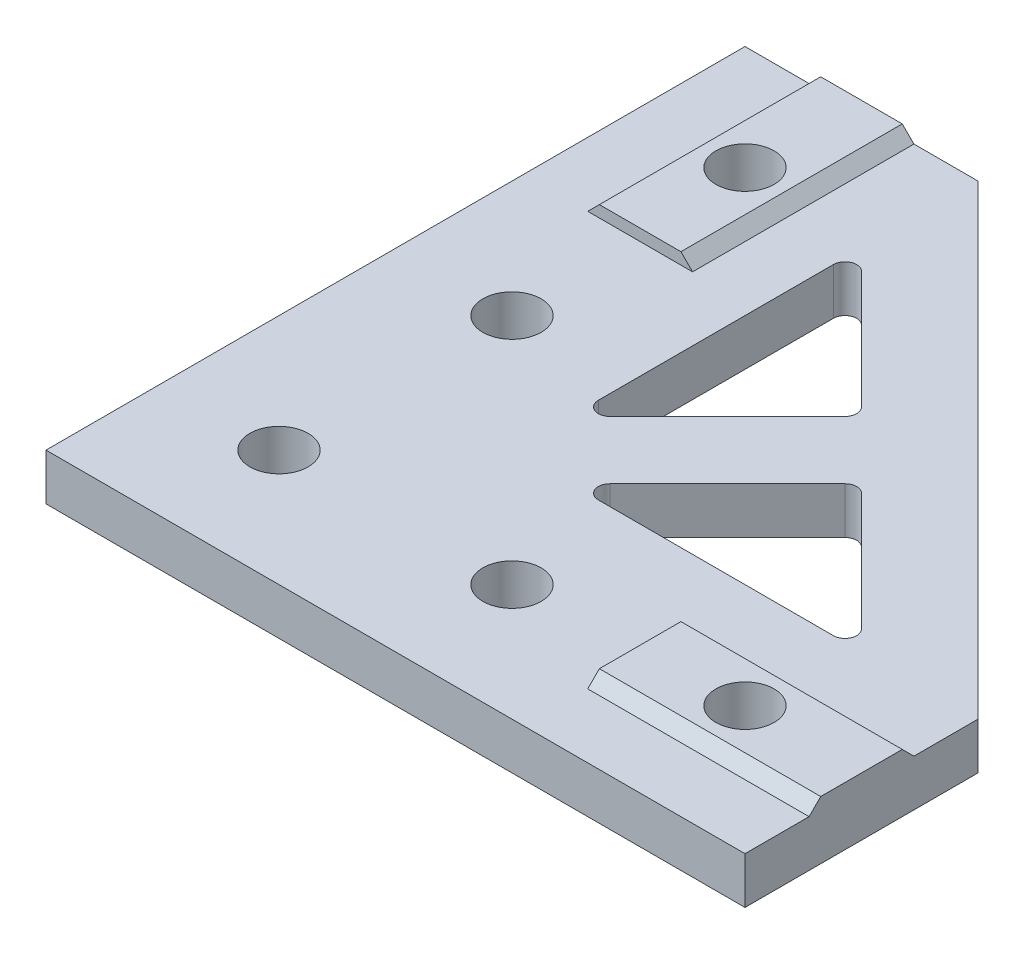
from build123d import *

# Parameters (mm, degrees)
BOSS_EXTRUDE1_DEPTH     = 4
SKETCH3_W               = 9
SKETCH3_H               = 19
SKETCH3_W_2             = 19
SKETCH3_H_2             = 9
BOSS_EXTRUDE2_DEPTH     = 1
CHAMFER1_SIZE           = 1
CUT_EXTRUDE1_DEPTH      = 86
CUT_EXTRUDE1_DEPTH_BACK = 86
SKETCH2_R               = 2.5


with BuildPart() as part:
    # Sketch1 → Boss-Extrude1 (new body)
    with BuildSketch(Plane(origin=(0, 0, 0), x_dir=(1, 0, 0), z_dir=(0, 1, 0))):
        Polygon((0, 0), (0, 60), (20, 60), (60, 20), (60, 0), align=None)
    extrude(amount=BOSS_EXTRUDE1_DEPTH)

    # Sketch3 → Boss-Extrude2 (add)
    with BuildSketch(Plane(origin=(0, 4, 0), x_dir=(1, 0, 0), z_dir=(0, 1, 0))):
        with Locations((10, 50.5)):
            Rectangle(SKETCH3_W, SKETCH3_H)
        with Locations((50.5, 10)):
            Rectangle(SKETCH3_W_2, SKETCH3_H_2)
    extrude(amount=BOSS_EXTRUDE2_DEPTH)

    # Chamfer1
    chamfer1_edges = [part.edges().sort_by_distance(p)[0] for p in [
        (50.5, 5, -14.5),
        (50.5, 5, -5.5),
        (14.5, 5, -50.5),
        (5.5, 5, -50.5),
    ]]
    chamfer(chamfer1_edges, length=CHAMFER1_SIZE - 0.0001)  # a hair under: the kernel refuses the full size

    # Sketch2 → Cut-Extrude1 (cut, two sides: drawn at the far end of the back side and taken through both)
    with BuildSketch(Plane.XZ.offset(-CUT_EXTRUDE1_DEPTH_BACK)):
        with Locations(Location((50, -10, 0), (0, 0, 270))):
            Circle(SKETCH2_R)
        with Locations(Location((30, -10, 0), (0, 0, 90))):
            Circle(SKETCH2_R)
        with Locations(Location((10, -10, 0), (0, 0, 90))):
            Circle(SKETCH2_R)
        with Locations(Location((10, -30, 0), (0, 0, 90))):
            Circle(SKETCH2_R)
        with Locations(Location((10, -50, 0), (0, 0, 270))):
            Circle(SKETCH2_R)
        with BuildLine():
            Line((48.292989119, -21.707106781), (38.207130756, -31.792965144))
            ThreePointArc((38.207130756, -31.792965144), (37.500023975, -32.085858363), (36.792917194, -31.792965144))
            Line((36.792917194, -31.792965144), (26.707058831, -21.707106781))
            ThreePointArc((26.707058831, -21.707106781), (26.49028608, -20.617316568), (27.414165612, -20))
            Line((27.414165612, -20), (47.585882338, -20))
            ThreePointArc((47.585882338, -20), (48.509761871, -20.617316568), (48.292989119, -21.707106781))
        make_face()
        with BuildLine():
            Line((31.792965144, -36.792917194), (21.707106781, -26.707058831))
            ThreePointArc((21.707106781, -26.707058831), (20.617316568, -26.49028608), (20, -27.414165612))
            Line((20, -27.414165612), (20, -47.585882338))
            ThreePointArc((20, -47.585882338), (20.617316568, -48.509761871), (21.707106781, -48.292989119))
            Line((21.707106781, -48.292989119), (31.792965144, -38.207130756))
            ThreePointArc((31.792965144, -38.207130756), (32.085858363, -37.500023975), (31.792965144, -36.792917194))
        make_face()
    extrude(amount=CUT_EXTRUDE1_DEPTH + CUT_EXTRUDE1_DEPTH_BACK, mode=Mode.SUBTRACT)


solid = part.part
